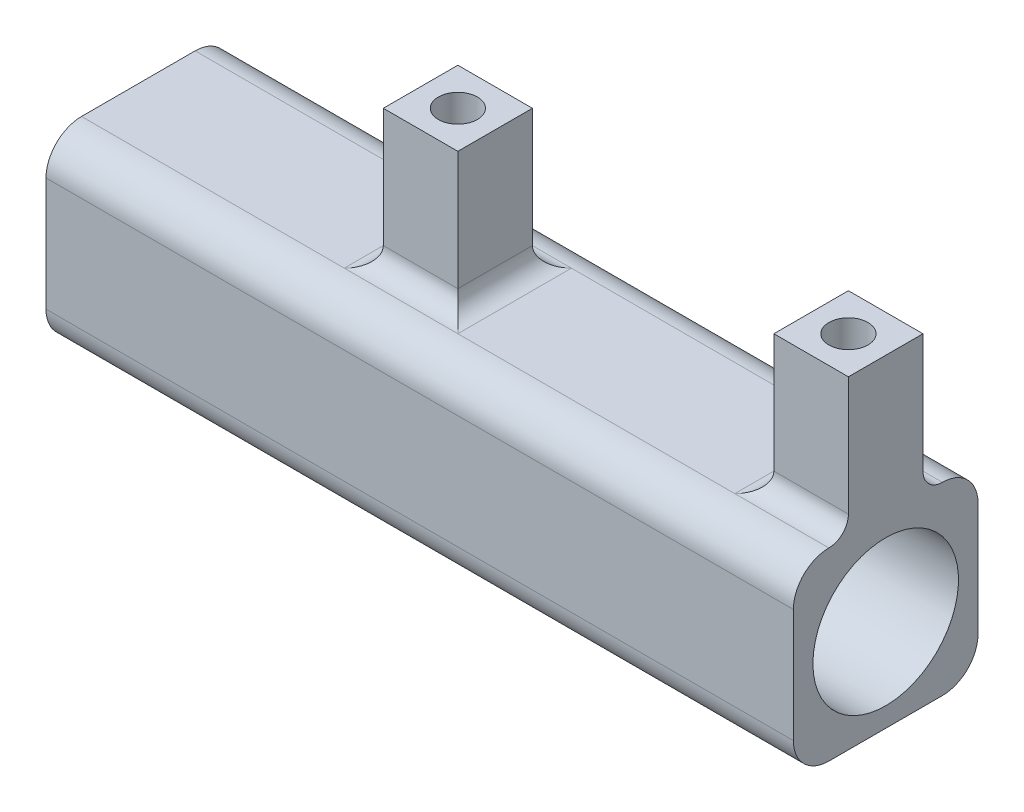
from build123d import *

# Parameters (mm, degrees)
SKETCH1_W               = 105.25
SKETCH1_H               = 26
BOSS_EXTRUDE1_DEPTH     = 13
SKETCH1_3_W             = 10.5
SKETCH1_3_H             = 19.5
BOSS_EXTRUDE2_DEPTH     = 5.25
SKETCH2_R               = 10.25
CUT_EXTRUDE1_DEPTH      = 111.918044069
CUT_EXTRUDE2_REACH      = 72.772
CUT_EXTRUDE2_END_RADIUS = 10.25
SKETCH3_R               = 2.75
FILLET1_R               = 5
FILLET4_R               = 2.75


with BuildPart() as part:
    # Sketch1 → Boss-Extrude1 (new, symmetric)
    with BuildSketch(Plane.XY):
        Rectangle(SKETCH1_W, SKETCH1_H)
    extrude(amount=BOSS_EXTRUDE1_DEPTH, both=True)

    # Sketch1<3> → Boss-Extrude2 (add, symmetric)
    with BuildSketch(Plane.XY):
        with Locations((-7.625, 22.75)):
            Rectangle(SKETCH1_3_W, SKETCH1_3_H)
        with Locations((47.375, 22.75)):
            Rectangle(SKETCH1_3_W, SKETCH1_3_H)
    extrude(amount=BOSS_EXTRUDE2_DEPTH, both=True)

    # Sketch2 → Cut-Extrude1 (cut, through all)
    with BuildSketch(Plane.ZY.offset(52.625)):
        Circle(SKETCH2_R)
    extrude(amount=-CUT_EXTRUDE1_DEPTH, mode=Mode.SUBTRACT)

    # Cut-Extrude2: up to this cylinder (the profile starts outside it)
    cut_extrude2_end = Plane(origin=(19.875, 0, 0), z_dir=(-1, 0, 0)) * Cylinder(CUT_EXTRUDE2_END_RADIUS, 222.044, mode=Mode.PRIVATE)
    # Sketch3 → Cut-Extrude2 (cut, up to the surface)
    with BuildSketch(Plane(origin=(0, 32.5, 0), x_dir=(1, 0, 0), z_dir=(0, 1, 0)), mode=Mode.PRIVATE) as cut_extrude2_sk1:
        with Locations(Location((-7.625, 0, 0), (0, 0, 270))):
            Circle(SKETCH3_R)
    cut_extrude2_tool1 = extrude(cut_extrude2_sk1.sketch, amount=-CUT_EXTRUDE2_REACH, mode=Mode.PRIVATE) - cut_extrude2_end
    add(cut_extrude2_tool1.solids().sort_by_distance((-7.625, 32.5, 0))[0], mode=Mode.SUBTRACT)
    # Sketch3 → Cut-Extrude2 (cut, up to the surface)
    with BuildSketch(Plane(origin=(0, 32.5, 0), x_dir=(1, 0, 0), z_dir=(0, 1, 0)), mode=Mode.PRIVATE) as cut_extrude2_sk2:
        with Locations(Location((47.375, 0, 0), (0, 0, 270))):
            Circle(SKETCH3_R)
    cut_extrude2_tool2 = extrude(cut_extrude2_sk2.sketch, amount=-CUT_EXTRUDE2_REACH, mode=Mode.PRIVATE) - cut_extrude2_end
    add(cut_extrude2_tool2.solids().sort_by_distance((47.375, 32.5, 0))[0], mode=Mode.SUBTRACT)

    # Fillet1
    fillet1_edges = [part.edges().sort_by_distance(p)[0] for p in [
        (0, 13, 13),
        (0, -13, 13),
        (0, -13, -13),
        (0, 13, -13),
    ]]
    fillet(fillet1_edges, radius=FILLET1_R)

    # Fillet4
    fillet4_edges = [part.edges().sort_by_distance(p)[0] for p in [
        (-12.875, 13, 0),
        (42.125, 13, 0),
        (-2.375, 13, 0),
        (47.375, 13, -5.25),
        (47.375, 13, 5.25),
        (-7.625, 13, 5.25),
        (-7.625, 13, -5.25),
    ]]
    fillet(fillet4_edges, radius=FILLET4_R - 0.0001)  # a hair under: the kernel refuses the full size


solid = part.part
